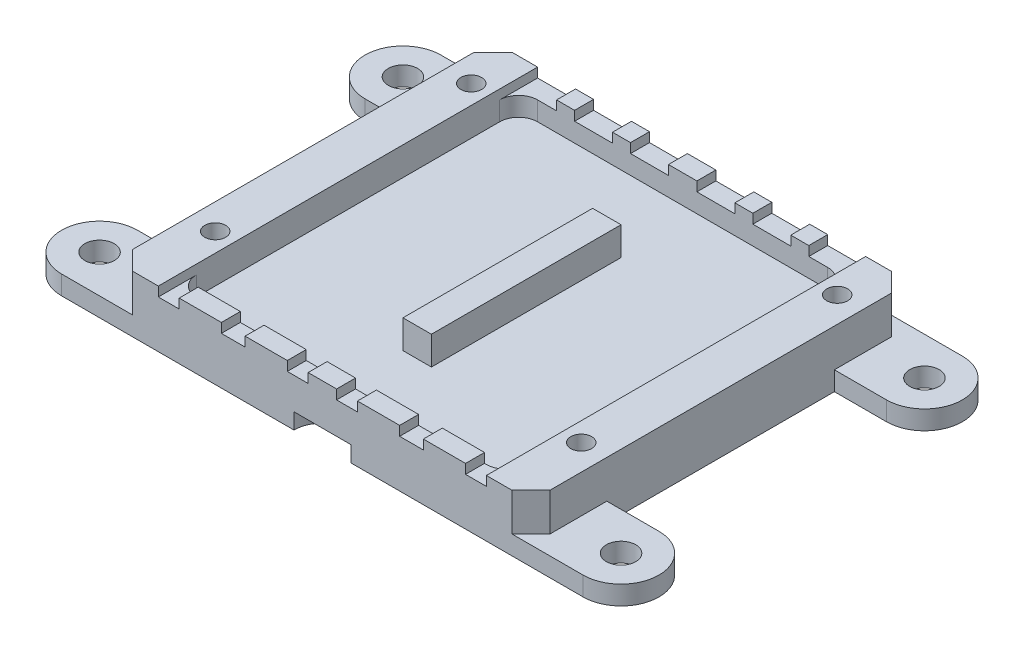
from build123d import *

# Parameters (mm, degrees)
SKETCH_1_R          = 1.55
EXTRUDE_1_DEPTH     = 2
SKETCH_2_W          = 44
SKETCH_2_H          = 40
EXTRUDE_2_DEPTH     = 4
SKETCH_3_W          = 34.6
SKETCH_3_H          = 36
SKETCH_3_W_2        = 3
SKETCH_3_H_2        = 20
CUT_EXTRUDE_1_DEPTH = 3
SKETCH_4_W          = 2.2
SKETCH_4_H          = 2
SKETCH_4_W_2        = 4
SKETCH_4_W_3        = 2.5
CUT_EXTRUDE_2_DEPTH = 1
FILLET_2_R          = 2
SKETCH_5_R          = 1.1
CUT_EXTRUDE_3_DEPTH = 38.792194961
SKETCH_6_R          = 2
CUT_EXTRUDE_4_DEPTH = 2.5
CHAMFER3_SIZE       = 2
SKETCH1_R           = 3
CUT_EXTRUDE1_DEPTH  = 1.67


with BuildPart() as part:
    # 草图1 → 凸台-拉伸1 (new body)
    with BuildSketch(Plane(origin=(0, 0, 0), x_dir=(1, 0, 0), z_dir=(0, 1, 0))):
        with BuildLine():
            Line((27.5, -20), (22, -20))
            Line((22, -20), (16, -20))
            Line((16, -20), (-16, -20))
            Line((-16, -20), (-22, -20))
            Line((-22, -20), (-27.5, -20))
            ThreePointArc((-27.5, -20), (-31.5, -16), (-27.5, -12))
            Line((-27.5, -12), (-22, -12))
            Line((-22, -12), (-22, 12))
            Line((-22, 12), (-27.5, 12))
            ThreePointArc((-27.5, 12), (-31.5, 16), (-27.5, 20))
            Line((-27.5, 20), (-22, 20))
            Line((-22, 20), (-16, 20))
            Line((-16, 20), (16, 20))
            Line((16, 20), (22, 20))
            Line((22, 20), (27.5, 20))
            ThreePointArc((27.5, 20), (31.5, 16), (27.5, 12))
            Line((27.5, 12), (22, 12))
            Line((22, 12), (22, -12))
            Line((22, -12), (27.5, -12))
            ThreePointArc((27.5, -12), (31.5, -16), (27.5, -20))
        make_face()
        with Locations((-27.5, -16)):
            Circle(SKETCH_1_R, mode=Mode.SUBTRACT)
        with Locations((-27.5, 16)):
            Circle(SKETCH_1_R, mode=Mode.SUBTRACT)
        with Locations((27.5, 16)):
            Circle(SKETCH_1_R, mode=Mode.SUBTRACT)
        with Locations((27.5, -16)):
            Circle(SKETCH_1_R, mode=Mode.SUBTRACT)
    extrude(amount=EXTRUDE_1_DEPTH)

    # 草图2 → 凸台-拉伸2 (add)
    with BuildSketch(Plane(origin=(0, 2, 0), x_dir=(1, 0, 0), z_dir=(0, 1, 0))):
        Rectangle(SKETCH_2_W, SKETCH_2_H)
    extrude(amount=EXTRUDE_2_DEPTH)

    # 草图3 → 切除-拉伸1 (cut)
    with BuildSketch(Plane(origin=(0, 6, 0), x_dir=(1, 0, 0), z_dir=(0, 1, 0))):
        Rectangle(SKETCH_3_W, SKETCH_3_H)
        Rectangle(SKETCH_3_W_2, SKETCH_3_H_2, mode=Mode.SUBTRACT)
    extrude(amount=-CUT_EXTRUDE_1_DEPTH, mode=Mode.SUBTRACT)

    # 草图4 → 切除-拉伸2 (cut)
    with BuildSketch(Plane(origin=(0, 6, 0), x_dir=(1, 0, 0), z_dir=(0, 1, 0))):
        with Locations((16.2, -19)):
            Rectangle(SKETCH_4_W, SKETCH_4_H)
        with Locations((-15.3, 19)):
            Rectangle(SKETCH_4_W_2, SKETCH_4_H)
        with Locations((15.3, 19)):
            Rectangle(SKETCH_4_W_2, SKETCH_4_H)
        with Locations((-16.2, -19)):
            Rectangle(SKETCH_4_W, SKETCH_4_H)
        with Locations((-3.5, 19)):
            Rectangle(SKETCH_4_W_2, SKETCH_4_H)
        with Locations((3.5, 19)):
            Rectangle(SKETCH_4_W_2, SKETCH_4_H)
        with Locations((2.6, -19)):
            Rectangle(SKETCH_4_W, SKETCH_4_H)
        with Locations((9.4, 19)):
            Rectangle(SKETCH_4_W_2, SKETCH_4_H)
        with Locations((-9.4, 19)):
            Rectangle(SKETCH_4_W_2, SKETCH_4_H)
        with Locations((-2.6, -19)):
            Rectangle(SKETCH_4_W, SKETCH_4_H)
        with Locations((-9.4, -19)):
            Rectangle(SKETCH_4_W_3, SKETCH_4_H)
        with Locations((9.4, -19)):
            Rectangle(SKETCH_4_W_3, SKETCH_4_H)
    extrude(amount=-CUT_EXTRUDE_2_DEPTH, mode=Mode.SUBTRACT)

    # 圆角2
    fillet_2_edges = [part.edges().sort_by_distance(p)[0] for p in [
        (17.3, 4, -18),
        (-17.3, 4, -18),
        (-17.3, 4, 18),
        (17.3, 4, 18),
    ]]
    fillet(fillet_2_edges, radius=FILLET_2_R)

    # 草图5 → 切除-拉伸3 (cut, through all)
    with BuildSketch(Plane(origin=(0, 6, 0), x_dir=(1, 0, 0), z_dir=(0, 1, 0))):
        with Locations((19.3, 15)):
            Circle(SKETCH_5_R)
        with Locations((19.3, -12)):
            Circle(SKETCH_5_R)
        with Locations((-19.3, -12)):
            Circle(SKETCH_5_R)
        with Locations((-19.3, 15)):
            Circle(SKETCH_5_R)
    extrude(amount=-CUT_EXTRUDE_3_DEPTH, mode=Mode.SUBTRACT)

    # 草图6 → 切除-拉伸4 (cut)
    with BuildSketch(Plane.XZ):
        with Locations((19.3, 12)):
            Circle(SKETCH_6_R)
        with Locations((-19.3, 12)):
            Circle(SKETCH_6_R)
        with Locations((-19.3, -15)):
            Circle(SKETCH_6_R)
        with Locations((19.3, -15)):
            Circle(SKETCH_6_R)
    extrude(amount=-CUT_EXTRUDE_4_DEPTH, mode=Mode.SUBTRACT)

    # Chamfer3
    chamfer3_edges = [part.edges().sort_by_distance(p)[0] for p in [
        (22, 4, 20),
        (-22, 4, 20),
        (-22, 4, -20),
        (22, 4, -20),
    ]]
    chamfer(chamfer3_edges, length=CHAMFER3_SIZE)

    # Sketch1 → Cut-Extrude1 (cut)
    with BuildSketch(Plane.XZ):
        with Locations((0, -20)):
            Circle(SKETCH1_R)
        with Locations((0, 20)):
            Circle(SKETCH1_R)
    extrude(amount=-CUT_EXTRUDE1_DEPTH, mode=Mode.SUBTRACT)


solid = part.part
